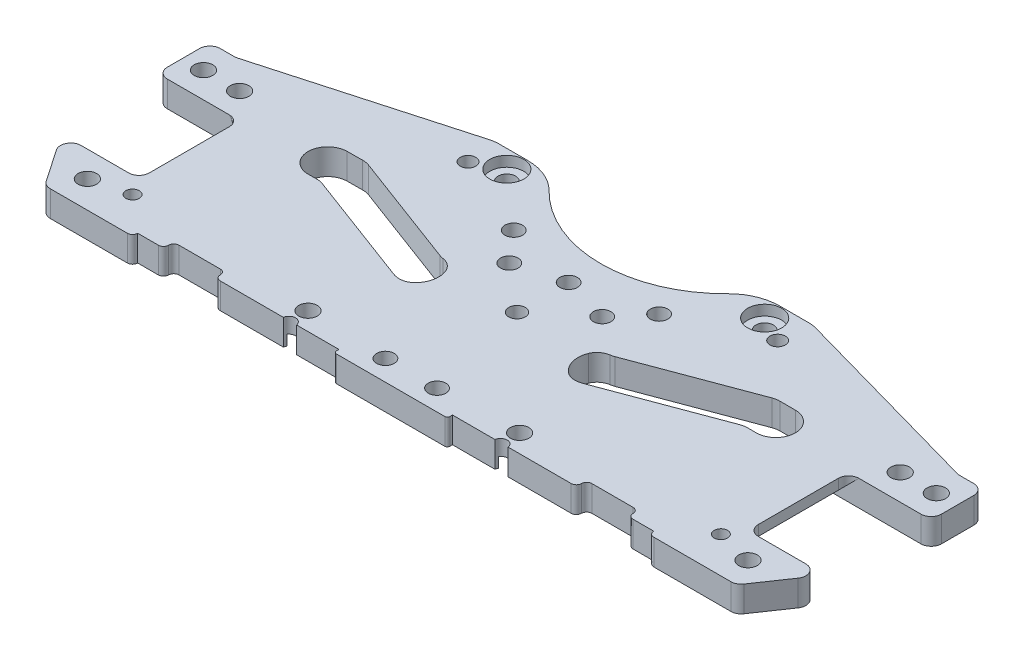
from build123d import *

# Parameters (mm, degrees)
SKETCH2_R           = 2.286
BOSS_EXTRUDE1_DEPTH = 6.35
CUT_EXTRUDE1_DEPTH  = 99.782817332
SKETCH4_R           = 1.905
BOSS_EXTRUDE2_DEPTH = 6.35
SKETCH5_R           = 30.7975
CUT_EXTRUDE2_DEPTH  = 104.26123135
FILLET1_R           = 12.7
SKETCH10_R          = 2.159
CUT_EXTRUDE6_DEPTH  = 104.26123135
SKETCH11_R          = 4.191
CUT_EXTRUDE7_DEPTH  = 2.54
CUT_EXTRUDE4_DEPTH  = 104.26123135
SKETCH6_W           = 6.35
SKETCH6_H           = 1.27
CUT_EXTRUDE3_DEPTH  = 7.62
SKETCH12_R          = 1.651
CUT_EXTRUDE8_DEPTH  = 104.26123135
SKETCH13_R          = 2.286
CUT_EXTRUDE9_DEPTH  = 104.26123135
SKETCH14_R          = 4.064
CUT_EXTRUDE10_DEPTH = 2.54
SKETCH17_R          = 2.159
CUT_EXTRUDE13_DEPTH = 104.26123135
SKETCH18_R          = 4.445
CUT_EXTRUDE14_DEPTH = 2.54
CHAMFER2_SIZE       = 3.81
FILLET3_R           = 2.54
FILLET4_R           = 1.27
SKETCH20_R          = 4.191
CUT_EXTRUDE16_DEPTH = 2.54
SKETCH21_R          = 2.159
CUT_EXTRUDE17_DEPTH = 104.26123135
SKETCH22_R          = 4.445
CUT_EXTRUDE18_DEPTH = 2.54
FILLET5_R           = 0.635
BOSS_EXTRUDE3_DEPTH = 6.35
FILLET7_R           = 3.81
SKETCH26_R          = 2.032
CUT_EXTRUDE20_DEPTH = 104.261231487
SKETCH27_R          = 4.445
CUT_EXTRUDE21_DEPTH = 2.54
CHAMFER1_SIZE       = 2.54
CUT_EXTRUDE24_DEPTH = 104.261231487
FILLET8_R           = 2.54


# Some blends are built 0.0001 mm under size
with BuildPart() as part:
    # Sketch2 → Boss-Extrude1 (new body)
    with BuildSketch(Plane(origin=(0, 0, 0), x_dir=(1, 0, 0), z_dir=(0, 1, 0))):
        Polygon((95.25, 25.4), (-95.25, 25.4), (-95.25, 12.3825), (-74.93, 12.3825), (-74.93, -12.3825), (-95.25, -12.3825), (-95.25, -25.4), (95.25, -25.4), (95.25, -12.3825), (74.93, -12.3825), (74.93, 12.3825), (95.25, 12.3825), align=None)
        with Locations(Location((-90.17, 18.7325, 0), (0, 0, 270))):
            Circle(SKETCH2_R, mode=Mode.SUBTRACT)
        with Locations(Location((-81.28, 18.7325, 0), (0, 0, 270))):
            Circle(SKETCH2_R, mode=Mode.SUBTRACT)
        with Locations(Location((-81.28, -18.7325, 0), (0, 0, 90))):
            Circle(SKETCH2_R, mode=Mode.SUBTRACT)
        with Locations(Location((81.28, -18.7325, 0), (0, 0, 270))):
            Circle(SKETCH2_R, mode=Mode.SUBTRACT)
        with Locations(Location((81.28, 18.7325, 0), (0, 0, 90))):
            Circle(SKETCH2_R, mode=Mode.SUBTRACT)
        with Locations(Location((90.17, 18.7325, 0), (0, 0, 90))):
            Circle(SKETCH2_R, mode=Mode.SUBTRACT)
    extrude(amount=BOSS_EXTRUDE1_DEPTH)

    # Sketch3 → Cut-Extrude1 (cut, through all)
    with BuildSketch(Plane(origin=(0, 6.35, 0), x_dir=(1, 0, 0), z_dir=(0, 1, 0))):
        with BuildLine():
            Line((21.59, -1.651), (-21.59, -1.651))
            ThreePointArc((-21.59, -1.651), (-22.44875555, -1.573980407), (-23.280100822, -1.345379985))
            Line((-23.280100822, -1.345379985), (-51.343837012, 9.147221025))
            ThreePointArc((-51.343837012, 9.147221025), (-52.195911729, 9.379523256), (-53.076052094, 9.452657281))
            Line((-53.076052094, 9.452657281), (-55.097082675, 9.435020014))
            ThreePointArc((-55.097082675, 9.435020014), (-59.965013176, 14.218721994), (-55.181311196, 19.086652495))
            Line((-55.181311196, 19.086652495), (-51.371456269, 19.119900596))
            ThreePointArc((-51.371456269, 19.119900596), (-50.491315903, 19.046766571), (-49.639241187, 18.81446434))
            Line((-49.639241187, 18.81446434), (-21.534734899, 8.306620015))
            ThreePointArc((-21.534734899, 8.306620015), (-20.703389627, 8.078019593), (-19.844634077, 8.001))
            Line((-19.844634077, 8.001), (19.844634077, 8.001))
            ThreePointArc((19.844634077, 8.001), (20.703389627, 8.078019593), (21.534734899, 8.306620015))
            Line((21.534734899, 8.306620015), (49.639241187, 18.81446434))
            ThreePointArc((49.639241187, 18.81446434), (50.491315903, 19.046766571), (51.371456269, 19.119900596))
            Line((51.371456269, 19.119900596), (55.181311196, 19.086652495))
            ThreePointArc((55.181311196, 19.086652495), (59.965013176, 14.218721994), (55.097082675, 9.435020014))
            Line((55.097082675, 9.435020014), (53.076052094, 9.452657281))
            ThreePointArc((53.076052094, 9.452657281), (52.195911729, 9.379523256), (51.343837012, 9.147221025))
            Line((51.343837012, 9.147221025), (23.280100822, -1.345379985))
            ThreePointArc((23.280100822, -1.345379985), (22.44875555, -1.573980407), (21.59, -1.651))
        make_face()
    extrude(amount=-CUT_EXTRUDE1_DEPTH, mode=Mode.SUBTRACT)

    # Sketch4 → Boss-Extrude2 (add)
    with BuildSketch(Plane(origin=(0, 6.35, 0), x_dir=(1, 0, 0), z_dir=(0, 1, 0))):
        with BuildLine():
            Line((-40.160032132, 39.086257058), (-88.9, 25.4))
            Line((-88.9, 25.4), (0, 25.4))
            Line((0, 25.4), (88.9, 25.4))
            Line((88.9, 25.4), (40.160032132, 39.086257058))
            ThreePointArc((40.160032132, 39.086257058), (39.139740646, 39.298730979), (38.1, 39.37))
            Line((38.1, 39.37), (-38.1, 39.37))
            ThreePointArc((-38.1, 39.37), (-39.139740646, 39.298730979), (-40.160032132, 39.086257058))
        make_face()
        with Locations(Location((-38.1, 31.75, 0), (0, 0, 270))):
            Circle(SKETCH4_R, mode=Mode.SUBTRACT)
        with Locations(Location((38.1, 31.75, 0), (0, 0, 270))):
            Circle(SKETCH4_R, mode=Mode.SUBTRACT)
    extrude(amount=-BOSS_EXTRUDE2_DEPTH)

    # Sketch5 → Cut-Extrude2 (cut, through all)
    with BuildSketch(Plane(origin=(0, 6.35, 0), x_dir=(1, 0, 0), z_dir=(0, 1, 0))):
        with Locations((0, 57.15)):
            Circle(SKETCH5_R)
    extrude(amount=-CUT_EXTRUDE2_DEPTH, mode=Mode.SUBTRACT)

    # Fillet1
    fillet1_edges = [part.edges().sort_by_distance(p)[0] for p in [
        (25.146721581, 3.175, -39.37),
        (-25.146721581, 3.175, -39.37),
    ]]
    fillet(fillet1_edges, radius=FILLET1_R)

    # Sketch10 → Cut-Extrude6 (cut, through all)
    with BuildSketch(Plane(origin=(0, 0, 0), x_dir=(-1, 0, 0), z_dir=(0, -1, 0))):
        with Locations(Location((-31.729854436, 34.932516738, 0), (0, 0, 90))):
            Circle(SKETCH10_R)
        with Locations(Location((-17.885832534, 22.791635377, 0), (0, 0, 90))):
            Circle(SKETCH10_R)
        with Locations(Location((0, 18.415, 0), (0, 0, 90))):
            Circle(SKETCH10_R)
        with Locations(Location((17.885832534, 22.791635377, 0), (0, 0, 90))):
            Circle(SKETCH10_R)
        with Locations(Location((31.729854436, 34.932516738, 0), (0, 0, 90))):
            Circle(SKETCH10_R)
    extrude(amount=-CUT_EXTRUDE6_DEPTH, mode=Mode.SUBTRACT)

    # Sketch11 → Cut-Extrude7 (cut)
    with BuildSketch(Plane(origin=(0, 6.35, 0), x_dir=(1, 0, 0), z_dir=(0, 1, 0))):
        with Locations(Location((-31.729854436, 34.932516738, 0), (0, 0, 270))):
            Circle(SKETCH11_R)
        with Locations(Location((31.729854436, 34.932516738, 0), (0, 0, 270))):
            Circle(SKETCH11_R)
    extrude(amount=-CUT_EXTRUDE7_DEPTH, mode=Mode.SUBTRACT)

    # Sketch8 → Cut-Extrude4 (cut, through all)
    with BuildSketch(Plane(origin=(0, 6.35, 0), x_dir=(1, 0, 0), z_dir=(0, 1, 0))):
        with BuildLine():
            Line((38.1, -25.4), (13.97, -25.4))
            Line((13.97, -25.4), (13.97, -24.13))
            Line((13.97, -24.13), (24.403655463, -24.13))
            ThreePointArc((24.403655463, -24.13), (26.035, -22.733), (27.666344537, -24.13))
            Line((27.666344537, -24.13), (38.1, -24.13))
            Line((38.1, -24.13), (38.1, -25.4))
        make_face()
    cut_extrude4 = extrude(amount=-CUT_EXTRUDE4_DEPTH, mode=Mode.SUBTRACT)

    # Sketch6 → Cut-Extrude3 (cut)
    with BuildSketch(Plane(origin=(0, 6.35, 0), x_dir=(1, 0, 0), z_dir=(0, 1, 0))):
        with Locations((41.275, -24.765)):
            Rectangle(SKETCH6_W, SKETCH6_H)
        with Locations((60.325, -24.765)):
            Rectangle(SKETCH6_W, SKETCH6_H)
        Polygon((50.8, -21.59), (50.8, -25.4), (57.15, -25.4), (57.15, -24.13), (57.15, -21.59), align=None)
        Polygon((44.45, -24.13), (44.45, -25.4), (50.8, -25.4), (50.8, -21.59), (44.45, -21.59), align=None)
    cut_extrude3 = extrude(amount=-CUT_EXTRUDE3_DEPTH, mode=Mode.SUBTRACT)

    # Sketch12 → Cut-Extrude8 (cut, through all)
    with BuildSketch(Plane(origin=(0, 6.35, 0), x_dir=(1, 0, 0), z_dir=(0, 1, 0))):
        with Locations(Location((72.39, -16.51, 0), (0, 0, 270))):
            Circle(SKETCH12_R)
    cut_extrude8 = extrude(amount=-CUT_EXTRUDE8_DEPTH, mode=Mode.SUBTRACT)

    # Sketch13 → Cut-Extrude9 (cut, symmetric)
    with BuildSketch(Plane.XZ):
        with Locations(Location((26.035, 19.685, 0), (0, 0, 270))):
            Circle(SKETCH13_R)
    cut_extrude9 = extrude(amount=CUT_EXTRUDE9_DEPTH, both=True, mode=Mode.SUBTRACT)

    # Sketch14 → Cut-Extrude10 (cut)
    with BuildSketch(Plane.XZ):
        with Locations((26.035, 19.685)):
            Circle(SKETCH14_R)
    cut_extrude10 = extrude(amount=-CUT_EXTRUDE10_DEPTH, mode=Mode.SUBTRACT)

    # Mirror1: Cut-Extrude4, Cut-Extrude3, Cut-Extrude8, Cut-Extrude9, Cut-Extrude10 across plane
    add(cut_extrude4.mirror(Plane(origin=(0, 0, 0), x_dir=(0, 0, 1), z_dir=(1, 0, 0))), mode=Mode.SUBTRACT)
    add(cut_extrude3.mirror(Plane(origin=(0, 0, 0), x_dir=(0, 0, 1), z_dir=(1, 0, 0))), mode=Mode.SUBTRACT)
    add(cut_extrude8.mirror(Plane(origin=(0, 0, 0), x_dir=(0, 0, 1), z_dir=(1, 0, 0))), mode=Mode.SUBTRACT)
    add(cut_extrude9.mirror(Plane(origin=(0, 0, 0), x_dir=(0, 0, 1), z_dir=(1, 0, 0))), mode=Mode.SUBTRACT)
    add(cut_extrude10.mirror(Plane(origin=(0, 0, 0), x_dir=(0, 0, 1), z_dir=(1, 0, 0))), mode=Mode.SUBTRACT)

    # Sketch17 → Cut-Extrude13 (cut, through all)
    with BuildSketch(Plane.XZ):
        with Locations(Location((11.43, -15.24, 0), (0, 0, 270))):
            Circle(SKETCH17_R)
        with Locations(Location((-11.43, -15.24, 0), (0, 0, 270))):
            Circle(SKETCH17_R)
    extrude(amount=-CUT_EXTRUDE13_DEPTH, mode=Mode.SUBTRACT)

    # Sketch18 → Cut-Extrude14 (cut)
    with BuildSketch(Plane.XZ):
        with Locations(Location((-11.43, -15.24, 0), (0, 0, 270))):
            Circle(SKETCH18_R)
        with Locations(Location((11.43, -15.24, 0), (0, 0, 270))):
            Circle(SKETCH18_R)
        with Locations(Location((-38.1, -31.75, 0), (0, 0, 270))):
            Circle(SKETCH18_R)
        with Locations(Location((38.1, -31.75, 0), (0, 0, 270))):
            Circle(SKETCH18_R)
    extrude(amount=-CUT_EXTRUDE14_DEPTH, mode=Mode.SUBTRACT)

    # Chamfer2
    chamfer2_edges = [part.edges().sort_by_distance(p)[0] for p in [
        (74.93, 0, 0),
        (-74.93, 0, 0),
    ]]
    chamfer(chamfer2_edges, length=CHAMFER2_SIZE)

    # Fillet3
    fillet3_edges = [part.edges().sort_by_distance(p)[0] for p in [
        (-88.9, 3.175, -25.4),
        (88.9, 3.175, -25.4),
        (-95.25, 3.175, -25.4),
        (95.25, 3.175, -25.4),
        (95.25, 3.175, -12.3825),
        (74.93, 5.08, -12.3825),
        (74.93, 5.08, 12.3825),
        (95.25, 3.175, 12.3825),
        (95.25, 3.175, 25.4),
        (-95.25, 3.175, 25.4),
        (-95.25, 3.175, 12.3825),
        (-74.93, 5.08, 12.3825),
        (-74.93, 5.08, -12.3825),
        (-95.25, 3.175, -12.3825),
    ]]
    fillet(fillet3_edges, radius=FILLET3_R - 0.0001)  # a hair under: the kernel refuses the full size

    # Fillet4
    # the kernel refuses this fillet: 1.27 mm, written as the material it adds along each edge
    with BuildSketch(Plane(origin=(-44.45, 6.35, 21.59), x_dir=(-1, 0, 0), z_dir=(0, -1, 0)), Plane(origin=(-57.15, 6.35, 21.59), x_dir=(0, 0, 1), z_dir=(0, -1, 0)), Plane(origin=(57.15, 6.35, 21.59), x_dir=(-1, 0, 0), z_dir=(0, -1, 0)), Plane(origin=(44.45, 6.35, 21.59), x_dir=(0, 0, 1), z_dir=(0, -1, 0))) as fillet4_piece_1:
        with BuildLine():
            CenterArc((FILLET4_R, -FILLET4_R), FILLET4_R, 90, 90)
            Line((0, -FILLET4_R), (0, 0))
            Line((0, 0), (FILLET4_R, 0))
        make_face()
    extrude(amount=6.35)
    # the kernel refuses this fillet: 1.27 mm, written as the material it takes off along each edge
    with BuildSketch(Plane(origin=(-44.45, 9.525, 24.13), x_dir=(1, 0, 0), z_dir=(0, -1, 0)), Plane(origin=(-63.5, 9.525, 25.4), x_dir=(0, 0, -1), z_dir=(0, -1, 0)), Plane(origin=(-57.15, 9.525, 24.13), x_dir=(0, 0, -1), z_dir=(0, -1, 0)), Plane(origin=(63.5, 9.525, 25.4), x_dir=(1, 0, 0), z_dir=(0, -1, 0)), Plane(origin=(57.15, 9.525, 24.13), x_dir=(1, 0, 0), z_dir=(0, -1, 0)), Plane(origin=(44.45, 9.525, 24.13), x_dir=(0, 0, -1), z_dir=(0, -1, 0))) as fillet4_2_piece_1:
        with BuildLine():
            CenterArc((FILLET4_R, -FILLET4_R), FILLET4_R, 90, 90)
            Line((0, -FILLET4_R), (0, 0))
            Line((0, 0), (FILLET4_R, 0))
        make_face()
    extrude(amount=12.7, mode=Mode.SUBTRACT)

    # Sketch20 → Cut-Extrude16 (cut)
    with BuildSketch(Plane.XZ):
        with Locations(Location((-81.28, 18.7325, 0), (0, 0, 270))):
            Circle(SKETCH20_R)
        with Locations(Location((-81.28, -18.7325, 0), (0, 0, 270))):
            Circle(SKETCH20_R)
        with Locations(Location((-90.17, -18.7325, 0), (0, 0, 270))):
            Circle(SKETCH20_R)
        with Locations(Location((90.17, -18.7325, 0), (0, 0, 90))):
            Circle(SKETCH20_R)
        with Locations(Location((81.28, -18.7325, 0), (0, 0, 90))):
            Circle(SKETCH20_R)
        with Locations(Location((81.28, 18.7325, 0), (0, 0, 90))):
            Circle(SKETCH20_R)
    extrude(amount=-CUT_EXTRUDE16_DEPTH, mode=Mode.SUBTRACT)

    # Sketch21 → Cut-Extrude17 (cut, through all)
    with BuildSketch(Plane(origin=(0, 6.35, 0), x_dir=(1, 0, 0), z_dir=(0, 1, 0))):
        with Locations(Location((-6.35, -20.32, 0), (0, 0, 270))):
            Circle(SKETCH21_R)
        with Locations(Location((6.35, -20.32, 0), (0, 0, 90))):
            Circle(SKETCH21_R)
    extrude(amount=-CUT_EXTRUDE17_DEPTH, mode=Mode.SUBTRACT)

    # Sketch22 → Cut-Extrude18 (cut)
    with BuildSketch(Plane(origin=(0, 0, 0), x_dir=(-1, 0, 0), z_dir=(0, -1, 0))):
        with Locations(Location((6.35, -20.32, 0), (0, 0, 90))):
            Circle(SKETCH22_R)
        with Locations(Location((-6.35, -20.32, 0), (0, 0, 90))):
            Circle(SKETCH22_R)
    extrude(amount=-CUT_EXTRUDE18_DEPTH, mode=Mode.SUBTRACT)

    # Fillet5
    fillet5_edges = [part.edges().sort_by_distance(p)[0] for p in [
        (13.97, 3.175, 25.4),
        (-13.97, 3.175, 25.4),
    ]]
    fillet(fillet5_edges, radius=FILLET5_R)

    # Sketch25 → Boss-Extrude3 (add)
    with BuildSketch(Plane(origin=(0, 6.35, 0), x_dir=(1, 0, 0), z_dir=(0, 1, 0))):
        with BuildLine():
            Line((22.86, -2.159), (-22.86, -2.159))
            ThreePointArc((-22.86, -2.159), (-17.145, 3.556), (-22.86, 9.271))
            Line((-22.86, 9.271), (22.86, 9.271))
            ThreePointArc((22.86, 9.271), (17.145, 3.556), (22.86, -2.159))
        make_face()
    extrude(amount=-BOSS_EXTRUDE3_DEPTH)

    # Fillet7
    fillet7_edges = [part.edges().sort_by_distance(p)[0] for p in [
        (-19.267897552, 3.175, -8.001),
        (-20.504500902, 3.175, 1.651),
        (20.504500902, 3.175, 1.651),
        (19.267897552, 3.175, -8.001),
    ]]
    fillet(fillet7_edges, radius=FILLET7_R)

    # Sketch26 → Cut-Extrude20 (cut, through all)
    with BuildSketch(Plane(origin=(0, 6.35, 0), x_dir=(1, 0, 0), z_dir=(0, 1, 0))):
        with Locations(Location((0, 5.715, 0), (0, 0, 270))):
            Circle(SKETCH26_R)
    extrude(amount=-CUT_EXTRUDE20_DEPTH, mode=Mode.SUBTRACT)

    # Sketch27 → Cut-Extrude21 (cut)
    with BuildSketch(Plane.XZ):
        with Locations(Location((0, -5.715, 0), (0, 0, 270))):
            Circle(SKETCH27_R)
    extrude(amount=-CUT_EXTRUDE21_DEPTH, mode=Mode.SUBTRACT)

    # Chamfer1
    # the kernel refuses this chamfer: 2.54 mm, written as the material it takes off along each edge
    with BuildSketch(Plane(origin=(72.39, 0, 16.51), x_dir=(0, 0, 1), z_dir=(-1, 0, 0))) as chamfer1_piece_1:
        Polygon((1.651, CHAMFER1_SIZE), (1.651 + CHAMFER1_SIZE, 0), (1.651, 0), align=None)
    revolve(axis=Axis((72.39, 0, 16.51), (0, 1, 0)), mode=Mode.SUBTRACT)
    with BuildSketch(Plane(origin=(-72.39, 0, 16.51), x_dir=(0, 0, 1), z_dir=(-1, 0, 0))) as chamfer1_piece_2:
        Polygon((1.651, CHAMFER1_SIZE), (1.651 + CHAMFER1_SIZE, 0), (1.651, 0), align=None)
    revolve(axis=Axis((-72.39, 0, 16.51), (0, 1, 0)), mode=Mode.SUBTRACT)

    # Sketch30 → Cut-Extrude24 (cut, through all)
    with BuildSketch(Plane(origin=(0, 6.35, 0), x_dir=(1, 0, 0), z_dir=(0, 1, 0))):
        Polygon((93.98, -12.3825), (85.09, -25.4), (95.25, -25.4), (95.25, -12.3825), align=None)
        Polygon((-95.25, -12.3825), (-93.98, -12.3825), (-85.09, -25.4), (-95.25, -25.4), align=None)
    extrude(amount=-CUT_EXTRUDE24_DEPTH, mode=Mode.SUBTRACT)

    # Fillet8
    fillet8_edges = [part.edges().sort_by_distance(p)[0] for p in [
        (93.809187327, 3.175, 12.632618557),
        (85.09, 3.175, 25.4),
        (-93.809187327, 3.175, 12.632618557),
        (-85.09, 3.175, 25.4),
    ]]
    fillet(fillet8_edges, radius=FILLET8_R)


solid = part.part
